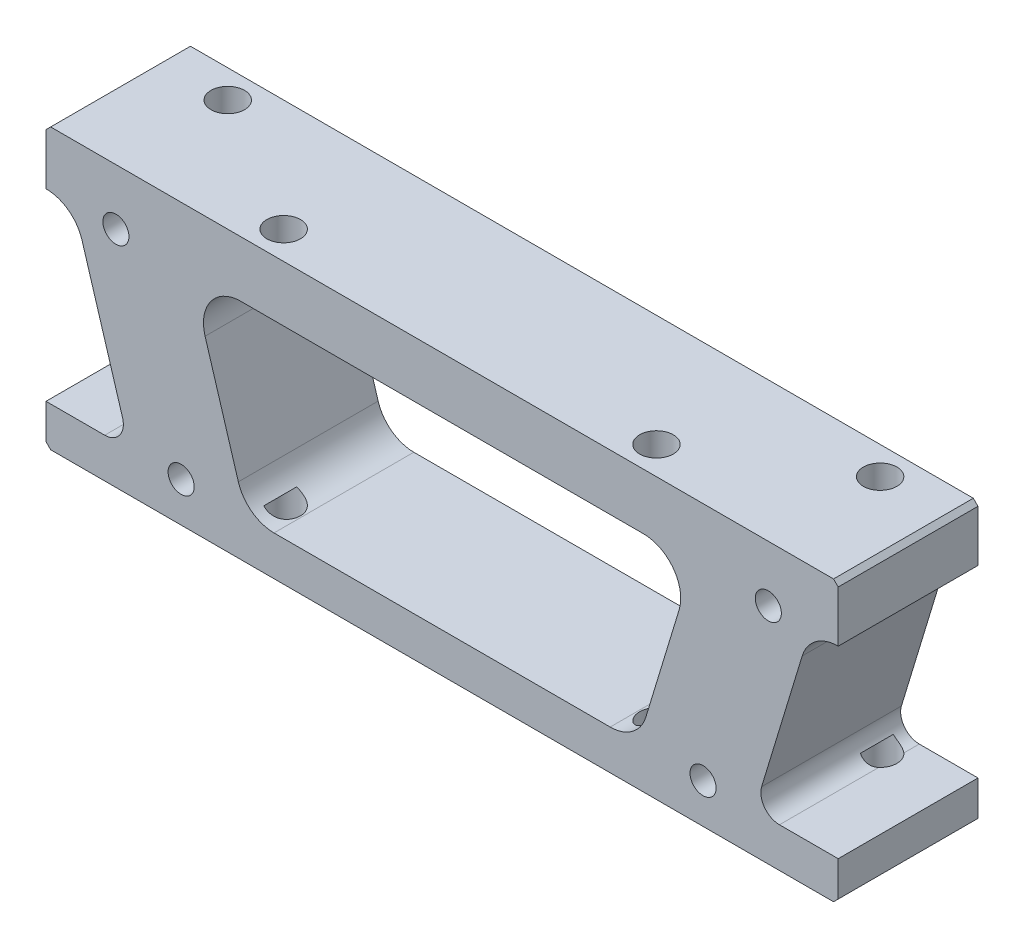
from build123d import *

# Parameters (mm, degrees)
SKETCH_1_W          = 85
SKETCH_1_H          = 15
EXTRUDE_1_DEPTH     = 30
SKETCH_2_R          = 1.4
CUT_EXTRUDE_1_DEPTH = 40
CUT_EXTRUDE_2_DEPTH = 40
FILLET_1_R          = 4
SKETCH_5_R          = 1.8
CUT_EXTRUDE_3_DEPTH = 5
CHAMFER_1_SIZE      = 0.5
CUT_EXTRUDE_4_DEPTH = 24
FILLET_3_R          = 4
CUT_EXTRUDE_START   = -5
SKETCH_9_R          = 1.8
CUT_EXTRUDE_5_DEPTH = 5
FILLET_4_R          = 2


with BuildPart() as part:
    # 草图1 → 凸台-拉伸1 (new body)
    with BuildSketch(Plane(origin=(0, 0, 0), x_dir=(1, 0, 0), z_dir=(0, 1, 0))):
        Rectangle(SKETCH_1_W, SKETCH_1_H)
    extrude(amount=EXTRUDE_1_DEPTH)

    # 草图2 → 切除-拉伸1 (cut)
    with BuildSketch(Plane.XY.offset(7.5)):
        with Locations((-35, 24)):
            Circle(SKETCH_2_R)
        with Locations((35, 24)):
            Circle(SKETCH_2_R)
        with Locations((28, 4.255699158)):
            Circle(SKETCH_2_R)
        with Locations((-28, 4.255699158)):
            Circle(SKETCH_2_R)
    extrude(amount=-CUT_EXTRUDE_1_DEPTH, mode=Mode.SUBTRACT)

    # 草图3 → 切除-拉伸2 (cut)
    with BuildSketch(Plane.XY.offset(7.5)):
        Polygon((-27, 24), (27, 24), (21, 4.255699158), (-21, 4.255699158), align=None)
    extrude(amount=-CUT_EXTRUDE_2_DEPTH, mode=Mode.SUBTRACT)

    # 圆角1
    fillet_1_edges = [part.edges().sort_by_distance(p)[0] for p in [
        (-21, 4.255699158, 0),
        (-27, 24, 0),
        (27, 24, 0),
        (21, 4.255699158, 0),
    ]]
    fillet(fillet_1_edges, radius=FILLET_1_R)

    # 草图5 → 切除-拉伸3 (cut)
    with BuildSketch(Plane(origin=(0, 30, 0), x_dir=(1, 0, 0), z_dir=(0, 1, 0))):
        with Locations(Location((-35, 4.5, 0), (0, 0, 270))):
            Circle(SKETCH_5_R)
        with Locations(Location((35, 4.5, 0), (0, 0, 270))):
            Circle(SKETCH_5_R)
        with Locations(Location((-20, -4.5, 0), (0, 0, 270))):
            Circle(SKETCH_5_R)
        with Locations(Location((20, -4.5, 0), (0, 0, 270))):
            Circle(SKETCH_5_R)
    extrude(amount=-CUT_EXTRUDE_3_DEPTH, mode=Mode.SUBTRACT)

    # 倒角1
    chamfer_1_edges = [part.edges().sort_by_distance(p)[0] for p in [
        (-42.5, 30, 0),
        (42.5, 30, 0),
        (-42.5, 0, 0),
        (42.5, 0, 0),
    ]]
    chamfer(chamfer_1_edges, length=CHAMFER_1_SIZE)

    # 草图6 → 切除-拉伸4 (cut)
    with BuildSketch(Plane.XY.offset(7.5)):
        Polygon((-42.5, 24), (-39.5, 24), (-33.5, 4.255699158), (-42.5, 4.255699158), align=None)
        Polygon((42.5, 24), (42.5, 4.255699158), (33.5, 4.255699158), (39.5, 24), align=None)
    extrude(amount=-CUT_EXTRUDE_4_DEPTH, mode=Mode.SUBTRACT)

    # 圆角3
    fillet_3_edges = [part.edges().sort_by_distance(p)[0] for p in [
        (-39.5, 24, 0),
        (39.5, 24, 0),
    ]]
    fillet(fillet_3_edges, radius=FILLET_3_R)

    # 草图9 → 切除-拉伸5 (cut)
    with BuildSketch(Plane.XZ.offset(CUT_EXTRUDE_START)):
        with Locations(Location((20, 4.5, 0), (0, 0, 90))):
            Circle(SKETCH_9_R)
        with Locations(Location((-20, 4.5, 0), (0, 0, 90))):
            Circle(SKETCH_9_R)
        with Locations(Location((-35, -4.5, 0), (0, 0, 90))):
            Circle(SKETCH_9_R)
        with Locations(Location((35, -4.5, 0), (0, 0, 90))):
            Circle(SKETCH_9_R)
    extrude(amount=CUT_EXTRUDE_5_DEPTH, mode=Mode.SUBTRACT)

    # 圆角4
    # the kernel refuses this fillet: 2 mm, written as the material it adds along each edge
    with BuildSketch(Plane(origin=(-33.5, 4.255699158, 7.5), x_dir=(-1, 0, 0), z_dir=(0, 0, -1))) as fillet_4_piece_1_section:
        with BuildLine():
            CenterArc((FILLET_4_R * 1.34903882702, FILLET_4_R), FILLET_4_R, 163.096751643, 106.903248357)
            Line((FILLET_4_R * 0.392241725729, FILLET_4_R * 1.29075643923), (0, 0))
            Line((0, 0), (FILLET_4_R * 1.34903882702, 0))
        make_face()
    fillet_4_piece_1 = extrude(amount=17.750206698, mode=Mode.PRIVATE)
    fillet_4_piece_1 = split(fillet_4_piece_1, bisect_by=Plane(origin=(-34.397620366, 4.568933738, -7.5), z_dir=(0, 0, 1)), keep=Keep.TOP, mode=Mode.PRIVATE)
    fillet_4_piece_1 = fillet_4_piece_1 - Plane(origin=(-35, 4.568933738, -4.5), x_dir=(0, 0, 1), z_dir=(0, 1, 0)) * Cylinder(1.8, 47, mode=Mode.PRIVATE)
    add(fillet_4_piece_1)
    with BuildSketch(Plane(origin=(-33.5, 4.255699158, 7.5), x_dir=(-1, 0, 0), z_dir=(0, 0, -1))) as fillet_4_piece_2_section:
        with BuildLine():
            CenterArc((FILLET_4_R * 1.34903882702, FILLET_4_R), FILLET_4_R, 163.096751643, 106.903248357)
            Line((FILLET_4_R * 0.392241725729, FILLET_4_R * 1.29075643923), (0, 0))
            Line((0, 0), (FILLET_4_R * 1.34903882702, 0))
        make_face()
    fillet_4_piece_2 = extrude(amount=17.750206698, mode=Mode.PRIVATE)
    fillet_4_piece_2 = split(fillet_4_piece_2, bisect_by=Plane(origin=(-34.145110505, 5.458310784, -7.5), z_dir=(0, 0, 1)), keep=Keep.TOP, mode=Mode.PRIVATE)
    fillet_4_piece_2 = split(fillet_4_piece_2, bisect_by=Plane(origin=(-34.145110505, 5, -4.499999953), z_dir=(0, 1, 0)), keep=Keep.TOP, mode=Mode.PRIVATE)
    add(fillet_4_piece_2)
    with BuildSketch(Plane(origin=(33.5, 4.255699158, 7.5), x_dir=(0.2907564392301515, 0.9567971012948373, 0), z_dir=(0, 0, -1))) as fillet_4_piece_3_section:
        with BuildLine():
            CenterArc((FILLET_4_R * 1.34903882702, FILLET_4_R), FILLET_4_R, 163.096751643, 106.903248357)
            Line((FILLET_4_R * 0.392241725729, FILLET_4_R * 1.29075643923), (0, 0))
            Line((0, 0), (FILLET_4_R * 1.34903882702, 0))
        make_face()
    fillet_4_piece_3 = extrude(amount=17.750206698, mode=Mode.PRIVATE)
    fillet_4_piece_3 = split(fillet_4_piece_3, bisect_by=Plane(origin=(34.133275605, 5.45760424, -7.5), z_dir=(0, 0, 1)), keep=Keep.TOP, mode=Mode.PRIVATE)
    fillet_4_piece_3 = fillet_4_piece_3 - Plane(origin=(35, 5.45760424, -4.5), x_dir=(0, 0, 1), z_dir=(0, 1, 0)) * Cylinder(1.8, 47, mode=Mode.PRIVATE)
    add(fillet_4_piece_3)
    with BuildSketch(Plane(origin=(33.5, 4.255699158, 7.5), x_dir=(0.2907564392301515, 0.9567971012948373, 0), z_dir=(0, 0, -1))) as fillet_4_piece_4_section:
        with BuildLine():
            CenterArc((FILLET_4_R * 1.34903882702, FILLET_4_R), FILLET_4_R, 163.096751643, 106.903248357)
            Line((FILLET_4_R * 0.392241725729, FILLET_4_R * 1.29075643923), (0, 0))
            Line((0, 0), (FILLET_4_R * 1.34903882702, 0))
        make_face()
    fillet_4_piece_4 = extrude(amount=17.750206698, mode=Mode.PRIVATE)
    fillet_4_piece_4 = split(fillet_4_piece_4, bisect_by=Plane(origin=(34.145110504, 5.458310885, -7.5), z_dir=(0, 0, 1)), keep=Keep.TOP, mode=Mode.PRIVATE)
    fillet_4_piece_4 = split(fillet_4_piece_4, bisect_by=Plane(origin=(34.145110504, 5, -4.499999944), z_dir=(0, 1, 0)), keep=Keep.TOP, mode=Mode.PRIVATE)
    add(fillet_4_piece_4)


solid = part.part
